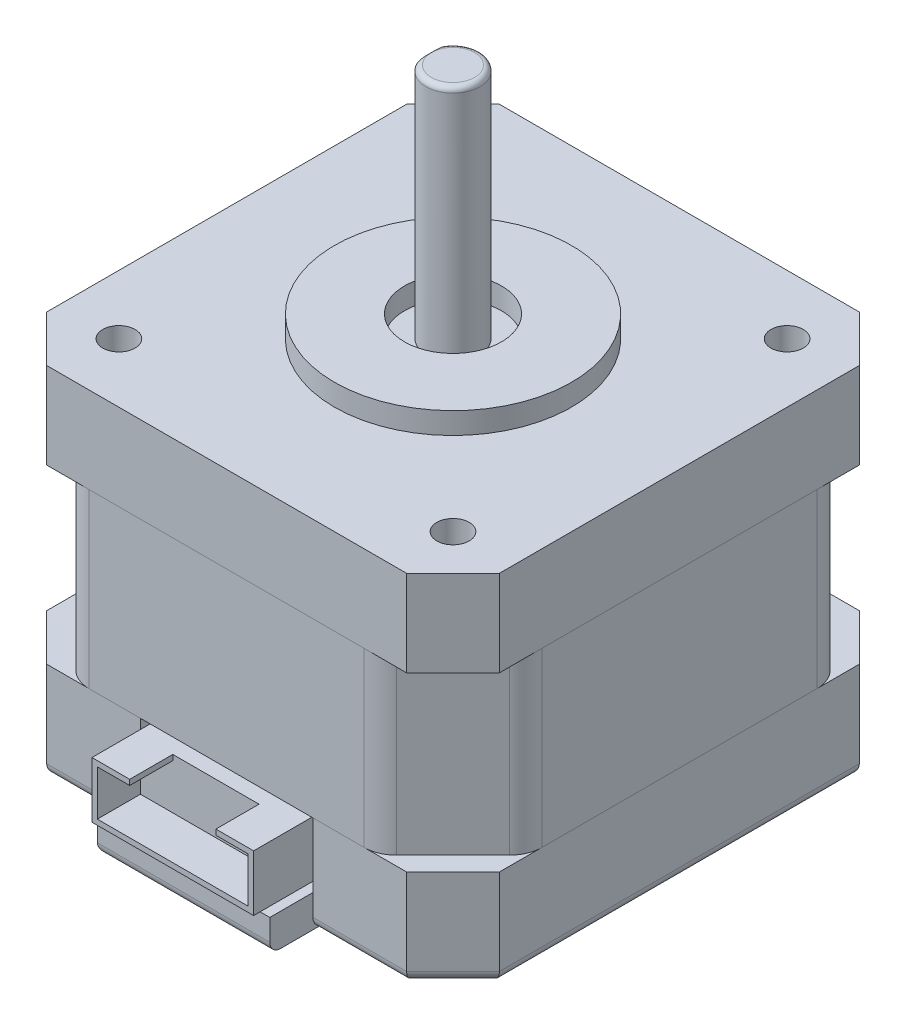
from build123d import *

# Parameters (mm, degrees)
SKETCH1_W           = 42
SKETCH1_H           = 42
SKETCH1_R           = 1.5
BOSS_EXTRUDE1_DEPTH = 8
SKETCH2_R           = 11
SKETCH2_R_2         = 4.5
BOSS_EXTRUDE2_DEPTH = 10
SKETCH3_W           = 42
SKETCH3_H           = 42
BOSS_EXTRUDE3_DEPTH = 16
BOSS_EXTRUDE4_DEPTH = 9
CHAMFER1_SIZE       = 4.3
CHAMFER5_SIZE       = 4.3
CHAMFER6_SIZE       = 7
FILLET1_R           = 3
SKETCH7_R           = 2.75
CUT_EXTRUDE3_DEPTH  = 3
SKETCH8_W           = 16
SKETCH8_H           = 25
BOSS_EXTRUDE5_DEPTH = 3
FILLET2_R           = 1
BOSS_EXTRUDE6_DEPTH = 26
SKETCH10_R          = 4.5
CUT_EXTRUDE4_DEPTH  = 2
SKETCH11_R          = 2.5
SKETCH11_R_2        = 2
CUT_EXTRUDE5_DEPTH  = 0.5
FILLET3_R           = 0.5
FILLET4_R           = 0.5
SKETCH12_R          = 2.5
BOSS_EXTRUDE7_DEPTH = 3
FILLET5_R           = 2
CUT_EXTRUDE6_DEPTH  = 2
SKETCH14_R          = 2.5
BOSS_EXTRUDE8_DEPTH = 30
FILLET6_R           = 0.5
SKETCH15_W          = 2
SKETCH15_H          = 3
CUT_EXTRUDE7_DEPTH  = 18
SKETCH16_W          = 15
SKETCH16_H          = 5.2
BOSS_EXTRUDE9_DEPTH = 22


with BuildPart() as part:
    # Sketch1 → Boss-Extrude1 (new body)
    with BuildSketch(Plane(origin=(0, 0, 0), x_dir=(1, 0, 0), z_dir=(0, 1, 0))):
        Rectangle(SKETCH1_W, SKETCH1_H)
        with Locations(Location((-15.5, 15.5, 0), (0, 0, 270))):
            Circle(SKETCH1_R, mode=Mode.SUBTRACT)
        with Locations(Location((15.5, 15.5, 0), (0, 0, 270))):
            Circle(SKETCH1_R, mode=Mode.SUBTRACT)
        with Locations(Location((-15.5, -15.5, 0), (0, 0, 270))):
            Circle(SKETCH1_R, mode=Mode.SUBTRACT)
        with Locations(Location((15.5, -15.5, 0), (0, 0, 270))):
            Circle(SKETCH1_R, mode=Mode.SUBTRACT)
    extrude(amount=BOSS_EXTRUDE1_DEPTH)

    # Sketch2 → Boss-Extrude2 (add)
    with BuildSketch(Plane(origin=(0, 0, 0), x_dir=(1, 0, 0), z_dir=(0, 1, 0))):
        with Locations(Location((0, 0, 0), (0, 0, 270))):
            Circle(SKETCH2_R)
        with Locations(Location((0, 0, 0), (0, 0, 270))):
            Circle(SKETCH2_R_2, mode=Mode.SUBTRACT)
    extrude(amount=BOSS_EXTRUDE2_DEPTH)

    # Chamfer1
    chamfer1_edges = [part.edges().sort_by_distance(p)[0] for p in [
        (-21, 4, -21),
        (21, 4, -21),
        (21, 4, 21),
        (-21, 4, 21),
    ]]
    chamfer(chamfer1_edges, length=CHAMFER1_SIZE)

    # Sketch14 → Boss-Extrude8 (add)
    with BuildSketch(Plane(origin=(0, 0, 0), x_dir=(1, 0, 0), z_dir=(0, 1, 0))):
        with Locations(Location((0, 0, 0), (0, 0, 90))):
            Circle(SKETCH14_R)
    extrude(amount=BOSS_EXTRUDE8_DEPTH)

    # Fillet6
    fillet6_edges = [part.edges().sort_by_distance(p)[0] for p in [
        (0, 30, 2.5),
    ]]
    fillet(fillet6_edges, radius=FILLET6_R)

    # Sketch15 → Cut-Extrude7 (cut)
    with BuildSketch(Plane(origin=(0, 30, 0), x_dir=(1, 0, 0), z_dir=(0, 1, 0))):
        with Locations((-3, 0)):
            Rectangle(SKETCH15_W, SKETCH15_H)
    extrude(amount=-CUT_EXTRUDE7_DEPTH, mode=Mode.SUBTRACT)


with BuildPart() as body_2:
    # Sketch3 → Boss-Extrude3 (new body)
    with BuildSketch(Plane(origin=(0, 0, 0), x_dir=(1, 0, 0), z_dir=(0, 1, 0))):
        Rectangle(SKETCH3_W, SKETCH3_H)
    extrude(amount=-BOSS_EXTRUDE3_DEPTH)

    # Chamfer6
    chamfer6_edges = [body_2.edges().sort_by_distance(p)[0] for p in [
        (-21, -8, -21),
        (21, -8, -21),
        (21, -8, 21),
        (-21, -8, 21),
    ]]
    chamfer(chamfer6_edges, length=CHAMFER6_SIZE)

    # Fillet1
    fillet1_edges = [body_2.edges().sort_by_distance(p)[0] for p in [
        (14, -8, -21),
        (-14, -8, -21),
        (-21, -8, 14),
        (-21, -8, -14),
        (21, -8, 14),
        (21, -8, -14),
        (-14, -8, 21),
        (14, -8, 21),
    ]]
    fillet(fillet1_edges, radius=FILLET1_R)


with BuildPart() as body_3:
    # Sketch5 → Boss-Extrude4 (new body)
    with BuildSketch(Plane(origin=(0, -16, 0), x_dir=(-1, 0, 0), z_dir=(0, -1, 0))):
        Polygon((-21, 21), (21, 21), (21, -21), (8, -21), (8, -1), (-8, -1), (-8, -21), (-21, -21), align=None)
    extrude(amount=BOSS_EXTRUDE4_DEPTH)

    # Chamfer5
    chamfer5_edges = [body_3.edges().sort_by_distance(p)[0] for p in [
        (21, -20.5, -21),
        (-21, -20.5, -21),
        (-21, -20.5, 21),
        (21, -20.5, 21),
    ]]
    chamfer(chamfer5_edges, length=CHAMFER5_SIZE)

    # Sketch7 → Cut-Extrude3 (cut)
    with BuildSketch(Plane(origin=(0, -25, -25), x_dir=(1, 0, 0), z_dir=(0, 1, 0))):
        with Locations(Location((16, -41, 0), (0, 0, 270))):
            Circle(SKETCH7_R)
        with Locations(Location((-16, -41, 0), (0, 0, 270))):
            Circle(SKETCH7_R)
        with Locations(Location((16, -9, 0), (0, 0, 270))):
            Circle(SKETCH7_R)
        with Locations(Location((-16, -9, 0), (0, 0, 270))):
            Circle(SKETCH7_R)
    extrude(amount=CUT_EXTRUDE3_DEPTH, mode=Mode.SUBTRACT)

    # Sketch8 → Boss-Extrude5 (add)
    with BuildSketch(Plane(origin=(0, -25, 0), x_dir=(-1, 0, 0), z_dir=(0, -1, 0))):
        with Locations((0, -12.5)):
            Rectangle(SKETCH8_W, SKETCH8_H)
    extrude(amount=-BOSS_EXTRUDE5_DEPTH)

    # Fillet2
    fillet2_edges = [body_3.edges().sort_by_distance(p)[0] for p in [
        (-12.35, -25, 21),
        (12.35, -25, 21),
        (21, -25, 0),
        (-21, -25, 0),
        (0, -25, -21),
        (-18.85, -25, -18.85),
        (18.85, -25, -18.85),
        (-18.85, -25, 18.85),
        (18.85, -25, 18.85),
        (0, -25, 25),
        (-8, -25, 23),
    ]]
    fillet(fillet2_edges, radius=FILLET2_R)

    # Sketch9 → Boss-Extrude6 (add)
    with BuildSketch(Plane.XY):
        Polygon((-7, -16.9), (-7, -21.1), (7, -21.1), (7, -16.9), (4, -16.9), (4, -16.4), (7.5, -16.4), (7.5, -21.6), (-7.5, -21.6), (-7.5, -16.4), (-4, -16.4), (-4, -16.9), align=None)
    extrude(amount=BOSS_EXTRUDE6_DEPTH)

    # Sketch10 → Cut-Extrude4 (cut)
    with BuildSketch(Plane(origin=(0, -25, 0), x_dir=(-1, 0, 0), z_dir=(0, -1, 0))):
        with Locations(Location((0, 0, 0), (0, 0, 90))):
            Circle(SKETCH10_R)
    extrude(amount=-CUT_EXTRUDE4_DEPTH, mode=Mode.SUBTRACT)

    # Sketch11 → Cut-Extrude5 (cut)
    with BuildSketch(Plane.XZ.offset(23)):
        with Locations(Location((0, 0, 0), (0, 0, 270))):
            Circle(SKETCH11_R)
        with Locations(Location((0, 0, 0), (0, 0, 270))):
            Circle(SKETCH11_R_2, mode=Mode.SUBTRACT)
    extrude(amount=-CUT_EXTRUDE5_DEPTH, mode=Mode.SUBTRACT)

    # Fillet3
    fillet3_edges = [body_3.edges().sort_by_distance(p)[0] for p in [
        (0, -23, 2),
    ]]
    fillet(fillet3_edges, radius=FILLET3_R - 0.0001)  # a hair under: the kernel refuses the full size

    # Fillet4
    fillet4_edges = [body_3.edges().sort_by_distance(p)[0] for p in [
        (0, -25, 4.5),
        (-16, -25, 13.25),
        (16, -25, -18.75),
        (-16, -25, -18.75),
        (16, -25, 13.25),
    ]]
    fillet(fillet4_edges, radius=FILLET4_R)

    # Sketch12 → Boss-Extrude7 (add)
    with BuildSketch(Plane.XZ.offset(22)):
        with Locations(Location((-16, 16, 0), (0, 0, 90))):
            Circle(SKETCH12_R)
        with Locations(Location((16, 16, 0), (0, 0, 90))):
            Circle(SKETCH12_R)
        with Locations(Location((-16, -16, 0), (0, 0, 90))):
            Circle(SKETCH12_R)
        with Locations(Location((16, -16, 0), (0, 0, 90))):
            Circle(SKETCH12_R)
    extrude(amount=BOSS_EXTRUDE7_DEPTH)

    # Fillet5
    fillet5_edges = [body_3.edges().sort_by_distance(p)[0] for p in [
        (-16, -25, 13.5),
        (16, -25, 13.5),
        (-16, -25, -18.5),
        (16, -25, -18.5),
    ]]
    fillet(fillet5_edges, radius=FILLET5_R)

    # Sketch13 → Cut-Extrude6 (cut)
    with BuildSketch(Plane(origin=(0, -25, 0), x_dir=(-1, 0, 0), z_dir=(0, -1, 0))):
        Polygon((16.5, -14), (16.5, -15.5), (18, -15.5), (18, -16.5), (16.5, -16.5), (16.5, -18), (15.5, -18), (15.5, -16.5), (14, -16.5), (14, -15.5), (15.5, -15.5), (15.5, -14), align=None)
        Polygon((-15.5, -14), (-15.5, -15.5), (-14, -15.5), (-14, -16.5), (-15.5, -16.5), (-15.5, -18), (-16.5, -18), (-16.5, -16.5), (-18, -16.5), (-18, -15.5), (-16.5, -15.5), (-16.5, -14), align=None)
        Polygon((-15.5, 18), (-15.5, 16.5), (-14, 16.5), (-14, 15.5), (-15.5, 15.5), (-15.5, 14), (-16.5, 14), (-16.5, 15.5), (-18, 15.5), (-18, 16.5), (-16.5, 16.5), (-16.5, 18), align=None)
        Polygon((16.5, 18), (16.5, 16.5), (18, 16.5), (18, 15.5), (16.5, 15.5), (16.5, 14), (15.5, 14), (15.5, 15.5), (14, 15.5), (14, 16.5), (15.5, 16.5), (15.5, 18), align=None)
    extrude(amount=-CUT_EXTRUDE6_DEPTH, mode=Mode.SUBTRACT)

    # Sketch16 → Boss-Extrude9 (add)
    with BuildSketch(Plane.XY):
        with Locations((0, -19)):
            Rectangle(SKETCH16_W, SKETCH16_H)
    extrude(amount=BOSS_EXTRUDE9_DEPTH)


solid = Compound([part.part, body_2.part, body_3.part])
